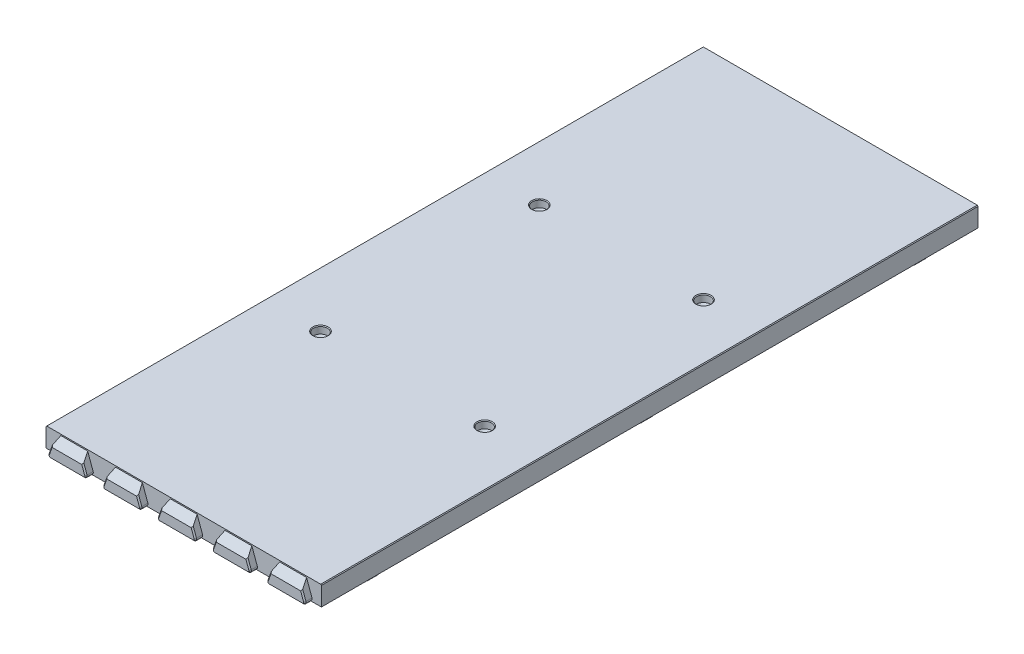
from build123d import *

# Parameters (mm, degrees)
BOSS_EXTRUDE1_DEPTH             = 135
SKETCH7_W                       = 109.25
SKETCH7_H                       = 6
BOSS_EXTRUDE7_DEPTH             = 1
BOSS_EXTRUDE4_DEPTH             = 3
BOSS_EXTRUDE8_REACH             = 148.613
BOSS_EXTRUDE8_DIRECTION_2_DEPTH = 2
CHAMFER4_SIZE                   = 0.5
FILLET4_R                       = 1
CHAMFER6_SIZE                   = 0.5
FILLET2_R                       = 2
CHAMFER4_OF_MIRROR2_SIZE        = 0.5
FILLET4_OF_MIRROR2_R            = 1
CHAMFER6_OF_MIRROR2_SIZE        = 0.5
FILLET2_OF_MIRROR2_R            = 2
BOSS_EXTRUDE9_REACH             = 280.925
SKETCH9_R                       = 5
FILLET3_R                       = 3
SKETCH10_R                      = 1.85
CUT_EXTRUDE2_DEPTH              = 279.92542126
SKETCH11_R                      = 2.85
CUT_EXTRUDE3_DEPTH              = 3
CHAMFER7_SIZE                   = 1
CUT_EXTRUDE4_DEPTH              = 279.92542126
CUT_EXTRUDE4_DEPTH_BACK         = 279.92542126
CHAMFER8_SIZE                   = 0.3


with BuildPart() as part:
    # Sketch1 → Boss-Extrude1 (new body)
    with BuildSketch(Plane.XY):
        Polygon((-56.625, 0), (-56.625, 8), (56.625, 8), (56.625, 0), (54.625, 0), (54.625, 6), (-54.625, 6), (-54.625, 0), align=None)
    boss_extrude1 = extrude(amount=-BOSS_EXTRUDE1_DEPTH)

    # Sketch7 → Boss-Extrude7 (add)
    with BuildSketch(Plane.XY):
        with Locations((0, 3)):
            Rectangle(SKETCH7_W, SKETCH7_H)
    boss_extrude7 = extrude(amount=-BOSS_EXTRUDE7_DEPTH)

    # Sketch2 → Boss-Extrude4 (add)
    with BuildSketch(Plane.XY):
        Polygon((39.661761874, 8), (36.75, 0), (53.25, 0), (50.338238126, 8), align=None)
        Polygon((17.161761874, 8), (14.25, 0), (30.75, 0), (27.838238126, 8), align=None)
        Polygon((-5.338238126, 8), (-8.25, 0), (8.25, 0), (5.338238126, 8), align=None)
        Polygon((-27.838238126, 8), (-30.75, 0), (-14.25, 0), (-17.161761874, 8), align=None)
        Polygon((-50.338238126, 8), (-53.25, 0), (-36.75, 0), (-39.661761874, 8), align=None)
    boss_extrude4 = extrude(amount=BOSS_EXTRUDE4_DEPTH)

    # Sketch8 → Boss-Extrude8 (add, up to next)
    with BuildSketch(Plane.XZ, mode=Mode.PRIVATE) as boss_extrude8_sk1:
        Polygon((-55.25, -24.955880937), (-55.25, -20.044119063), (-51.25, -21.5), (-51.25, -23.5), align=None)
    boss_extrude8_tool1 = extrude(boss_extrude8_sk1.sketch, amount=-BOSS_EXTRUDE8_REACH, mode=Mode.PRIVATE) - part.part
    # Sketch8 → Boss-Extrude8 (add, up to next)
    with BuildSketch(Plane.XZ, mode=Mode.PRIVATE) as boss_extrude8_sk2:
        Polygon((-55.25, -135), (-55.25, -132.544119063), (-51.25, -134), (-51.25, -135), align=None)
    boss_extrude8_tool2 = extrude(boss_extrude8_sk2.sketch, amount=-BOSS_EXTRUDE8_REACH, mode=Mode.PRIVATE) - part.part
    # Sketch8 → Boss-Extrude8 (add, up to next)
    with BuildSketch(Plane.XZ, mode=Mode.PRIVATE) as boss_extrude8_sk3:
        Polygon((55.25, -24.955880937), (51.25, -23.5), (51.25, -21.5), (55.25, -20.044119063), align=None)
    boss_extrude8_tool3 = extrude(boss_extrude8_sk3.sketch, amount=-BOSS_EXTRUDE8_REACH, mode=Mode.PRIVATE) - part.part
    # Sketch8 → Boss-Extrude8 (add, up to next)
    with BuildSketch(Plane.XZ, mode=Mode.PRIVATE) as boss_extrude8_sk4:
        Polygon((51.25, -135), (55.25, -135), (55.25, -132.544119063), (51.25, -134), align=None)
    boss_extrude8_tool4 = extrude(boss_extrude8_sk4.sketch, amount=-BOSS_EXTRUDE8_REACH, mode=Mode.PRIVATE) - part.part
    boss_extrude8_1 = boss_extrude8_tool1.solids().sort_by_distance((-53.530851, 0, -22.5))[0]
    add(boss_extrude8_1)
    boss_extrude8_2 = boss_extrude8_tool2.solids().sort_by_distance((-53.530851, 0, -134.084919))[0]
    add(boss_extrude8_2)
    boss_extrude8_3 = boss_extrude8_tool3.solids().sort_by_distance((53.530851, 0, -22.5))[0]
    add(boss_extrude8_3)
    boss_extrude8_4 = boss_extrude8_tool4.solids().sort_by_distance((53.530851, 0, -134.084919))[0]
    add(boss_extrude8_4)
    boss_extrude8 = boss_extrude8_1 + boss_extrude8_2 + boss_extrude8_3 + boss_extrude8_4  # Boss-Extrude8 as one shape, for the pattern or mirror that repeats it

    # Sketch8 → Boss-Extrude8 direction 2 (add)
    with BuildSketch(Plane.XZ):
        Polygon((-55.25, -24.955880937), (-55.25, -20.044119063), (-51.25, -21.5), (-51.25, -23.5), align=None)
        Polygon((-55.25, -135), (-55.25, -132.544119063), (-51.25, -134), (-51.25, -135), align=None)
        Polygon((55.25, -24.955880937), (51.25, -23.5), (51.25, -21.5), (55.25, -20.044119063), align=None)
        Polygon((51.25, -135), (55.25, -135), (55.25, -132.544119063), (51.25, -134), align=None)
    boss_extrude8_direction_2 = extrude(amount=BOSS_EXTRUDE8_DIRECTION_2_DEPTH)

    # Chamfer4
    chamfer4_edges = [part.edges().sort_by_distance(p)[0] for p in [
        (-51.25, -2, -134.5),
        (-53.25, -2, -133.272059531),
        (-55.25, -2, -133.772059531),
        (-53.25, -2, -20.772059531),
        (-55.25, -2, -22.5),
        (-53.25, -2, -24.227940469),
        (-51.25, -2, -22.5),
        (55.25, -2, -22.5),
        (53.25, -2, -20.772059531),
        (51.25, -2, -22.5),
        (53.25, -2, -24.227940469),
        (51.25, -2, -134.5),
        (55.25, -2, -133.772059531),
        (53.25, -2, -133.272059531),
    ]]
    chamfer(chamfer4_edges, length=CHAMFER4_SIZE)

    # Fillet4
    fillet4_edges = [part.edges().sort_by_distance(p)[0] for p in [
        (36.75, 0, 1.5),
        (53.25, 0, 1.5),
        (14.25, 0, 1.5),
        (30.75, 0, 1.5),
        (-8.25, 0, 1.5),
        (8.25, 0, 1.5),
        (-53.25, 0, 1.5),
        (-36.75, 0, 1.5),
        (-30.75, 0, 1.5),
        (-14.25, 0, 1.5),
    ]]
    fillet(fillet4_edges, radius=FILLET4_R)

    # Chamfer6
    chamfer6_edges = [part.edges().sort_by_distance(p)[0] for p in [
        (51.54989137, 4.671010072, 3),
        (45, 0, 3),
        (22.5, 0, 3),
        (0, 0, 3),
        (-22.5, 0, 3),
        (-45, 0, 3),
        (37.358995962, 0.426423564, 3),
        (52.641004038, 0.426423564, 3),
        (29.04989137, 4.671010072, 3),
        (14.858995962, 0.426423564, 3),
        (30.141004038, 0.426423564, 3),
        (6.54989137, 4.671010072, 3),
        (-7.641004038, 0.426423564, 3),
        (7.641004038, 0.426423564, 3),
        (-15.95010863, 4.671010072, 3),
        (-30.141004038, 0.426423564, 3),
        (-14.858995962, 0.426423564, 3),
        (-38.45010863, 4.671010072, 3),
        (-52.641004038, 0.426423564, 3),
        (-37.358995962, 0.426423564, 3),
        (38.45010863, 4.671010072, 3),
        (15.95010863, 4.671010072, 3),
        (-6.54989137, 4.671010072, 3),
        (-51.54989137, 4.671010072, 3),
        (-29.04989137, 4.671010072, 3),
    ]]
    chamfer(chamfer6_edges, length=CHAMFER6_SIZE)

    # Fillet2
    fillet2_edges = [part.edges().sort_by_distance(p)[0] for p in [
        (-54.625, 6, -78.75),
        (-54.625, 3, -132.771600459),
        (-51.25, 6, -134.5),
        (-52.9375, 6, -133.38580023),
        (-54.625, 6, -10.63580023),
        (-54.625, 3, -20.271600459),
        (-54.625, 3, -24.728399541),
        (-52.9375, 6, -20.88580023),
        (-51.25, 6, -22.5),
        (-52.9375, 6, -24.11419977),
        (54.625, 6, -10.63580023),
        (54.625, 3, -20.271600459),
        (54.625, 3, -24.728399541),
        (52.9375, 6, -20.88580023),
        (52.9375, 6, -24.11419977),
        (51.25, 6, -22.5),
        (54.625, 6, -78.75),
        (54.625, 3, -132.771600459),
        (51.25, 6, -134.5),
        (52.9375, 6, -133.38580023),
        (-54.625, 3, -1),
        (0, 6, -1),
        (54.625, 3, -1),
    ]]
    fillet(fillet2_edges, radius=FILLET2_R)


with BuildPart() as mirror2_1:
    # Mirror2: Boss-Extrude1, Boss-Extrude7, Boss-Extrude4, Boss-Extrude8, Boss-Extrude8 direction 2 across plane
    add(boss_extrude1.mirror(Plane.XY.offset(-135)))
    add(boss_extrude7.mirror(Plane.XY.offset(-135)))
    add(boss_extrude4.mirror(Plane.XY.offset(-135)))
    add(boss_extrude8.mirror(Plane.XY.offset(-135)))
    add(boss_extrude8_direction_2.mirror(Plane.XY.offset(-135)))

    # Chamfer4 of Mirror2
    chamfer4_of_mirror2_edges = [mirror2_1.edges().sort_by_distance(p)[0] for p in [
        (-51.25, -2, -135.5),
        (-53.25, -2, -136.727940469),
        (-55.25, -2, -136.227940469),
        (-53.25, -2, -249.227940469),
        (-55.25, -2, -247.5),
        (-53.25, -2, -245.772059531),
        (-51.25, -2, -247.5),
        (55.25, -2, -247.5),
        (53.25, -2, -249.227940469),
        (51.25, -2, -247.5),
        (53.25, -2, -245.772059531),
        (51.25, -2, -135.5),
        (55.25, -2, -136.227940469),
        (53.25, -2, -136.727940469),
    ]]
    chamfer(chamfer4_of_mirror2_edges, length=CHAMFER4_OF_MIRROR2_SIZE)

    # Fillet4 of Mirror2
    fillet4_of_mirror2_edges = [mirror2_1.edges().sort_by_distance(p)[0] for p in [
        (36.75, 0, -271.5),
        (53.25, 0, -271.5),
        (14.25, 0, -271.5),
        (30.75, 0, -271.5),
        (-8.25, 0, -271.5),
        (8.25, 0, -271.5),
        (-53.25, 0, -271.5),
        (-36.75, 0, -271.5),
        (-30.75, 0, -271.5),
        (-14.25, 0, -271.5),
    ]]
    fillet(fillet4_of_mirror2_edges, radius=FILLET4_OF_MIRROR2_R)

    # Chamfer6 of Mirror2
    chamfer6_of_mirror2_edges = [mirror2_1.edges().sort_by_distance(p)[0] for p in [
        (51.54989137, 4.671010072, -273),
        (45, 0, -273),
        (22.5, 0, -273),
        (0, 0, -273),
        (-22.5, 0, -273),
        (-45, 0, -273),
        (37.358995962, 0.426423564, -273),
        (52.641004038, 0.426423564, -273),
        (29.04989137, 4.671010072, -273),
        (14.858995962, 0.426423564, -273),
        (30.141004038, 0.426423564, -273),
        (6.54989137, 4.671010072, -273),
        (-7.641004038, 0.426423564, -273),
        (7.641004038, 0.426423564, -273),
        (-15.95010863, 4.671010072, -273),
        (-30.141004038, 0.426423564, -273),
        (-14.858995962, 0.426423564, -273),
        (-38.45010863, 4.671010072, -273),
        (-52.641004038, 0.426423564, -273),
        (-37.358995962, 0.426423564, -273),
        (38.45010863, 4.671010072, -273),
        (15.95010863, 4.671010072, -273),
        (-6.54989137, 4.671010072, -273),
        (-51.54989137, 4.671010072, -273),
        (-29.04989137, 4.671010072, -273),
    ]]
    chamfer(chamfer6_of_mirror2_edges, length=CHAMFER6_OF_MIRROR2_SIZE)

    # Fillet2 of Mirror2
    fillet2_of_mirror2_edges = [mirror2_1.edges().sort_by_distance(p)[0] for p in [
        (-54.625, 6, -191.25),
        (-54.625, 3, -137.228399541),
        (-51.25, 6, -135.5),
        (-52.9375, 6, -136.61419977),
        (-54.625, 6, -259.36419977),
        (-54.625, 3, -249.728399541),
        (-54.625, 3, -245.271600459),
        (-52.9375, 6, -249.11419977),
        (-51.25, 6, -247.5),
        (-52.9375, 6, -245.88580023),
        (54.625, 6, -259.36419977),
        (54.625, 3, -249.728399541),
        (54.625, 3, -245.271600459),
        (52.9375, 6, -249.11419977),
        (52.9375, 6, -245.88580023),
        (51.25, 6, -247.5),
        (54.625, 6, -191.25),
        (54.625, 3, -137.228399541),
        (51.25, 6, -135.5),
        (52.9375, 6, -136.61419977),
        (-54.625, 3, -269),
        (0, 6, -269),
        (54.625, 3, -269),
    ]]
    fillet(fillet2_of_mirror2_edges, radius=FILLET2_OF_MIRROR2_R)


with BuildPart() as part_1:
    add(part.part)

    # Mirror2 united with what the copies touc: union Mirror2_1
    add(mirror2_1.part)

    # Sketch9 → Boss-Extrude9 (add, up to next)
    with BuildSketch(Plane(origin=(0, 0, 0), x_dir=(1, 0, 0), z_dir=(0, 1, 0)), mode=Mode.PRIVATE) as boss_extrude9_sk1:
        with Locations(Location((-33.75, 90, 0), (0, 0, 90))):
            Circle(SKETCH9_R)
    boss_extrude9_tool1 = extrude(boss_extrude9_sk1.sketch, amount=BOSS_EXTRUDE9_REACH, mode=Mode.PRIVATE) - part_1.part
    # Sketch9 → Boss-Extrude9 (add, up to next)
    with BuildSketch(Plane(origin=(0, 0, 0), x_dir=(1, 0, 0), z_dir=(0, 1, 0)), mode=Mode.PRIVATE) as boss_extrude9_sk2:
        with Locations(Location((33.75, 90, 0), (0, 0, 90))):
            Circle(SKETCH9_R)
    boss_extrude9_tool2 = extrude(boss_extrude9_sk2.sketch, amount=BOSS_EXTRUDE9_REACH, mode=Mode.PRIVATE) - part_1.part
    # Sketch9 → Boss-Extrude9 (add, up to next)
    with BuildSketch(Plane(origin=(0, 0, 0), x_dir=(1, 0, 0), z_dir=(0, 1, 0)), mode=Mode.PRIVATE) as boss_extrude9_sk3:
        with Locations(Location((33.75, 180, 0), (0, 0, 90))):
            Circle(SKETCH9_R)
    boss_extrude9_tool3 = extrude(boss_extrude9_sk3.sketch, amount=BOSS_EXTRUDE9_REACH, mode=Mode.PRIVATE) - part_1.part
    # Sketch9 → Boss-Extrude9 (add, up to next)
    with BuildSketch(Plane(origin=(0, 0, 0), x_dir=(1, 0, 0), z_dir=(0, 1, 0)), mode=Mode.PRIVATE) as boss_extrude9_sk4:
        with Locations(Location((-33.75, 180, 0), (0, 0, 90))):
            Circle(SKETCH9_R)
    boss_extrude9_tool4 = extrude(boss_extrude9_sk4.sketch, amount=BOSS_EXTRUDE9_REACH, mode=Mode.PRIVATE) - part_1.part
    add(boss_extrude9_tool1.solids().sort_by_distance((-33.75, 0, -90))[0])
    add(boss_extrude9_tool2.solids().sort_by_distance((33.75, 0, -90))[0])
    add(boss_extrude9_tool3.solids().sort_by_distance((33.75, 0, -180))[0])
    add(boss_extrude9_tool4.solids().sort_by_distance((-33.75, 0, -180))[0])

    # Fillet3
    fillet3_edges = [part_1.edges().sort_by_distance(p)[0] for p in [
        (-33.75, 6, -85),
        (-33.75, 6, -175),
        (33.75, 6, -175),
        (33.75, 6, -85),
    ]]
    fillet(fillet3_edges, radius=FILLET3_R)

    # Sketch10 → Cut-Extrude2 (cut, through all)
    with BuildSketch(Plane(origin=(0, 0, 0), x_dir=(1, 0, 0), z_dir=(0, 1, 0))):
        with Locations(Location((-33.75, 180, 0), (0, 0, 270))):
            Circle(SKETCH10_R)
        with Locations(Location((-33.75, 90, 0), (0, 0, 270))):
            Circle(SKETCH10_R)
        with Locations(Location((33.75, 90, 0), (0, 0, 270))):
            Circle(SKETCH10_R)
        with Locations(Location((33.75, 180, 0), (0, 0, 270))):
            Circle(SKETCH10_R)
    extrude(amount=CUT_EXTRUDE2_DEPTH, mode=Mode.SUBTRACT)

    # Sketch11 → Cut-Extrude3 (cut)
    with BuildSketch(Plane(origin=(0, 8, 0), x_dir=(1, 0, 0), z_dir=(0, 1, 0))):
        with Locations(Location((-33.75, 180, 0), (0, 0, 270))):
            Circle(SKETCH11_R)
        with Locations(Location((33.75, 180, 0), (0, 0, 270))):
            Circle(SKETCH11_R)
        with Locations(Location((33.75, 90, 0), (0, 0, 270))):
            Circle(SKETCH11_R)
        with Locations(Location((-33.75, 90, 0), (0, 0, 270))):
            Circle(SKETCH11_R)
    extrude(amount=-CUT_EXTRUDE3_DEPTH, mode=Mode.SUBTRACT)

    # Chamfer7
    chamfer7_edges = [part_1.edges().sort_by_distance(p)[0] for p in [
        (-33.75, 5, -91.85),
        (33.75, 5, -91.85),
        (33.75, 5, -181.85),
        (-33.75, 5, -181.85),
    ]]
    chamfer(chamfer7_edges, length=CHAMFER7_SIZE - 0.0001)  # a hair under: the kernel refuses the full size

    # Sketch12 → Cut-Extrude4 (cut, two sides: drawn at the far end of the back side and taken through both)
    with BuildSketch(Plane(origin=(0, 0, 0), x_dir=(0, 0, -1), z_dir=(1, 0, 0)).offset(-CUT_EXTRUDE4_DEPTH_BACK)):
        Polygon((0, 7.5), (-3, 4.5), (-3, 7.5), (-3, 8), (0, 8), align=None)
        Polygon((273, 8), (273, 7.5), (273, 4.5), (270, 7.5), (270, 8), align=None)
    extrude(amount=CUT_EXTRUDE4_DEPTH + CUT_EXTRUDE4_DEPTH_BACK, mode=Mode.SUBTRACT)

    # Chamfer8
    chamfer8_edges = [part_1.edges().sort_by_distance(p)[0] for p in [
        (-56.625, 8, -135),
        (56.625, 8, -135),
        (-33.75, 8, -92.85),
        (33.75, 8, -92.85),
        (33.75, 8, -182.85),
        (-33.75, 8, -182.85),
    ]]
    chamfer(chamfer8_edges, length=CHAMFER8_SIZE)


solid = part_1.part
